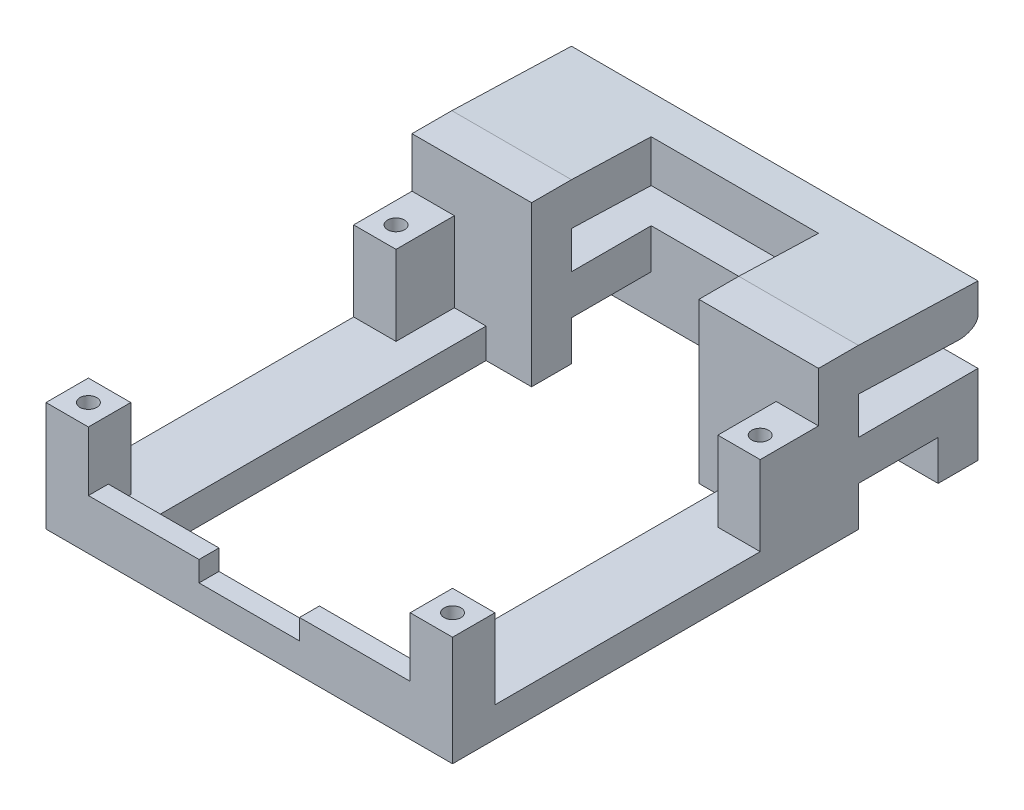
from build123d import *

# Parameters (mm, degrees)
SKETCH1_W               = 64.75
SKETCH1_H               = 83.69
SKETCH1_R               = 1.35
BOSS_EXTRUDE1_DEPTH     = 25.4
CUT_EXTRUDE1_DEPTH      = 82.17097095
SKETCH5_W               = 58.29
SKETCH5_H               = 20.6375
CUT_EXTRUDE3_DEPTH      = 82.17097095
BOSS_EXTRUDE2_START     = 4.7625
SKETCH1_3_W             = 6.75
SKETCH1_3_H             = 6.75
SKETCH1_3_R             = 1.35
SKETCH1_3_H_2           = 2.54
BOSS_EXTRUDE2_DEPTH     = 12.7
CUT_EXTRUDE6_DEPTH      = 55.409876401
CUT_EXTRUDE6_DEPTH_BACK = 55.409876401
SKETCH7_W               = 26.65
SKETCH7_H               = 12.7
SKETCH7_W_2             = 7.249
SKETCH7_H_2             = 55.115
SKETCH26_W              = 12.7
SKETCH26_H              = 6.35
CUT_EXTRUDE17_DEPTH     = 82.17097095
SKETCH22_W              = 17.625
SKETCH22_H              = 3.2375
BOSS_EXTRUDE6_DEPTH     = 3.175


with BuildPart() as part:
    # Sketch1 → Boss-Extrude1 (new body)
    with BuildSketch(Plane(origin=(0, 0, 0), x_dir=(1, 0, 0), z_dir=(0, 1, 0))):
        Rectangle(SKETCH1_W, SKETCH1_H)
        with Locations(Location((-29, 10.53, 0), (0, 0, 270))):
            Circle(SKETCH1_R, mode=Mode.SUBTRACT)
        with Locations(Location((-29, -38.47, 0), (0, 0, 270))):
            Circle(SKETCH1_R, mode=Mode.SUBTRACT)
        with Locations(Location((29, 10.53, 0), (0, 0, 270))):
            Circle(SKETCH1_R, mode=Mode.SUBTRACT)
        with Locations(Location((29, -38.47, 0), (0, 0, 270))):
            Circle(SKETCH1_R, mode=Mode.SUBTRACT)
    extrude(amount=BOSS_EXTRUDE1_DEPTH)

    # Sketch3 → Cut-Extrude1 (cut, through all)
    with BuildSketch(Plane(origin=(32.375, 0, 0), x_dir=(0, 0, -1), z_dir=(1, 0, 0))):
        Polygon((41.845, 18.034), (22.795, 18.669), (22.795, 12.7), (41.845, 12.7), align=None)
        Polygon((41.845, 25.4), (22.795, 25.4), (41.845, 24.765), align=None)
    extrude(amount=-CUT_EXTRUDE1_DEPTH, mode=Mode.SUBTRACT)

    # Sketch5 → Cut-Extrude3 (cut, through all)
    with BuildSketch(Plane(origin=(32.375, 0, 0), x_dir=(0, 0, -1), z_dir=(1, 0, 0))):
        with Locations((-12.7, 15.08125)):
            Rectangle(SKETCH5_W, SKETCH5_H)
    extrude(amount=-CUT_EXTRUDE3_DEPTH, mode=Mode.SUBTRACT)

    # Sketch1<3> → Boss-Extrude2 (add)
    # profile 1 of 6: a face of its own
    with BuildSketch(Plane(origin=(0, 0, 0), x_dir=(1, 0, 0), z_dir=(0, 1, 0)).offset(BOSS_EXTRUDE2_START)):
        with Locations((29, -38.47)):
            Rectangle(SKETCH1_3_W, SKETCH1_3_H)
        with Locations(Location((29, -38.47, 0), (0, 0, 90))):
            Circle(SKETCH1_3_R, mode=Mode.SUBTRACT)
    # profile 2 of 6: a face of its own
    with BuildSketch(Plane(origin=(0, 0, 0), x_dir=(1, 0, 0), z_dir=(0, 1, 0)).offset(BOSS_EXTRUDE2_START)):
        with Locations((-29, -38.47)):
            Rectangle(SKETCH1_3_W, SKETCH1_3_H)
        with Locations(Location((-29, -38.47, 0), (0, 0, 90))):
            Circle(SKETCH1_3_R, mode=Mode.SUBTRACT)
    # profile 3 of 6: a face of its own
    with BuildSketch(Plane(origin=(0, 0, 0), x_dir=(1, 0, 0), z_dir=(0, 1, 0)).offset(BOSS_EXTRUDE2_START)):
        with Locations((-29, 10.53)):
            Rectangle(SKETCH1_3_W, SKETCH1_3_H)
        with Locations(Location((-29, 10.53, 0), (0, 0, 90))):
            Circle(SKETCH1_3_R, mode=Mode.SUBTRACT)
    # profile 4 of 6: a face of its own
    with BuildSketch(Plane(origin=(0, 0, 0), x_dir=(1, 0, 0), z_dir=(0, 1, 0)).offset(BOSS_EXTRUDE2_START)):
        with Locations((29, 10.53)):
            Rectangle(SKETCH1_3_W, SKETCH1_3_H)
        with Locations(Location((29, 10.53, 0), (0, 0, 90))):
            Circle(SKETCH1_3_R, mode=Mode.SUBTRACT)
    # profile 5 of 6: a face of its own
    with BuildSketch(Plane(origin=(0, 0, 0), x_dir=(1, 0, 0), z_dir=(0, 1, 0)).offset(BOSS_EXTRUDE2_START)):
        with Locations((-29, 15.175)):
            Rectangle(SKETCH1_3_W, SKETCH1_3_H_2)
    # profile 6 of 6: a face of its own
    with BuildSketch(Plane(origin=(0, 0, 0), x_dir=(1, 0, 0), z_dir=(0, 1, 0)).offset(BOSS_EXTRUDE2_START)):
        with Locations((29, 15.175)):
            Rectangle(SKETCH1_3_W, SKETCH1_3_H_2)
    extrude(amount=BOSS_EXTRUDE2_DEPTH)

    # Sketch7 → Cut-Extrude6 (cut, two sides: drawn at the far end of the back side and taken through both)
    with BuildSketch(Plane(origin=(0, 12.7, 0), x_dir=(1, 0, 0), z_dir=(0, 1, 0)).offset(-CUT_EXTRUDE6_DEPTH_BACK)):
        Polygon((-13.325, 16.445), (-13.325, -38.67), (13.325, -38.67), (13.325, 16.445), (13.325, 22.795), (-13.325, 22.795), align=None)
        with Locations((0, 29.145)):
            Rectangle(SKETCH7_W, SKETCH7_H)
        with Locations((-16.9495, -11.1125)):
            Rectangle(SKETCH7_W_2, SKETCH7_H_2)
        with Locations((16.9495, -11.1125)):
            Rectangle(SKETCH7_W_2, SKETCH7_H_2)
    extrude(amount=CUT_EXTRUDE6_DEPTH + CUT_EXTRUDE6_DEPTH_BACK, mode=Mode.SUBTRACT)

    # Sketch26 → Cut-Extrude17 (cut, through all)
    with BuildSketch(Plane(origin=(32.375, 0, 0), x_dir=(0, 0, -1), z_dir=(1, 0, 0))):
        with Locations((29.145, 3.175)):
            Rectangle(SKETCH26_W, SKETCH26_H)
    extrude(amount=-CUT_EXTRUDE17_DEPTH, mode=Mode.SUBTRACT)

    # Fillet1
    # an asymmetric fillet: 3.175, 1.905 mm, written as the material it takes off along each edge
    with BuildSketch(Plane(origin=(40.475658498, 18.034, -41.845), x_dir=(0, 1, 0), z_dir=(-1, 0, 0))) as fillet1_piece_1:
        with BuildLine():
            Bezier((2.011891373, 0), (0, 0), (0.107948825, -3.238464752), weights=[1, 0.695228441, 1])
            Line((0.107948825, -3.238464752), (0, 0))
            Line((0, 0), (2.011891373, 0))
        make_face()
    extrude(amount=80.951316996, mode=Mode.SUBTRACT)

    # Sketch22 → Boss-Extrude6 (add)
    with BuildSketch(Plane.XY.offset(41.845)):
        with Locations((-16.8125, 6.38125)):
            Rectangle(SKETCH22_W, SKETCH22_H)
        with Locations((16.8125, 6.38125)):
            Rectangle(SKETCH22_W, SKETCH22_H)
    extrude(amount=-BOSS_EXTRUDE6_DEPTH)


solid = part.part
